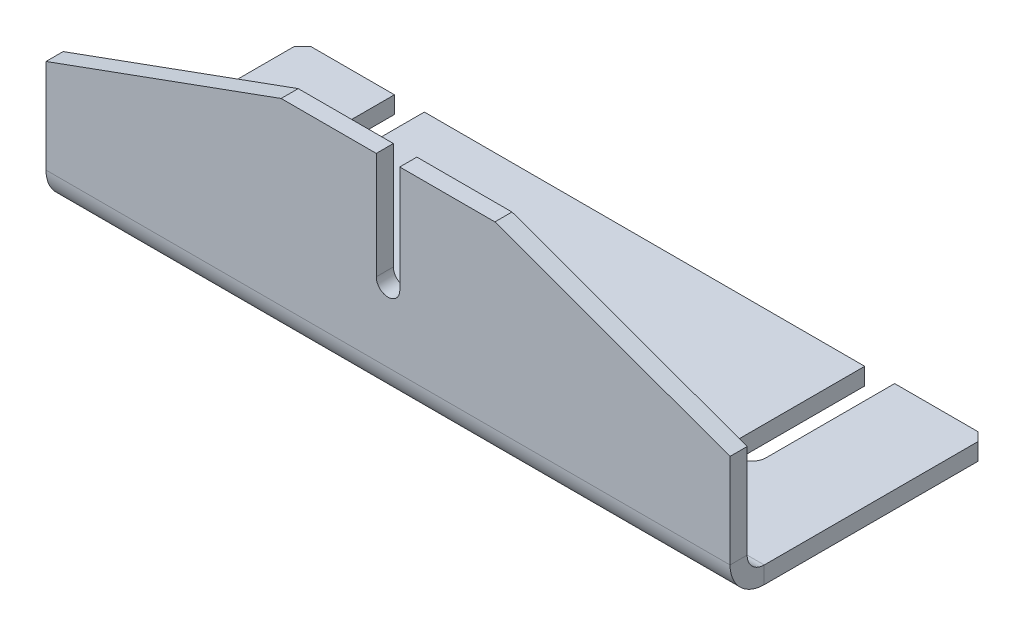
from build123d import *

# Parameters (mm, degrees)
BASE_FLANGE1_DEPTH = 80
CUT_EXTRUDE1_DEPTH = 110.708705215
SKETCH8_R          = 3.5
SKETCH8_W          = 7
SKETCH8_H          = 60
CUT_EXTRUDE2_DEPTH = 111.072703247
CHAMFER1_SIZE      = 2


# Sheet-metal steps are written as plain solids
with BuildPart() as part:
    # Sketch1 → Base-Flange1 (new, symmetric)
    with BuildSketch(Plane(origin=(0, 0, 0), x_dir=(0, 0, -1), z_dir=(1, 0, 0))):
        with BuildLine():
            Line((0, 50), (0, 8))
            ThreePointArc((0, 8), (2.343145751, 2.343145751), (8, 0))
            Line((8, 0), (60, 0))
            Line((60, 0), (60, 4))
            Line((60, 4), (8, 4))
            ThreePointArc((8, 4), (5.171572875, 5.171572875), (4, 8))
            Line((4, 8), (4, 50))
            Line((4, 50), (0, 50))
        make_face()
    extrude(amount=BASE_FLANGE1_DEPTH, both=True)

    # Sketch7 → Cut-Extrude1 (cut, through all)
    with BuildSketch(Plane(origin=(0, 0, -4), x_dir=(-1, 0, 0), z_dir=(0, 0, -1))):
        with BuildLine():
            Line((2.75, 50), (-2.75, 50))
            Line((-2.75, 50), (-2.75, 25))
            ThreePointArc((-2.75, 25), (0, 27.75), (2.75, 25))
            Line((2.75, 25), (2.75, 50))
        make_face()
        with BuildLine():
            ThreePointArc((2.75, 25), (0, 27.75), (-2.75, 25))
            Line((-2.75, 25), (2.75, 25))
        make_face()
        with BuildLine():
            Line((2.75, 25), (-2.75, 25))
            ThreePointArc((-2.75, 25), (0, 22.25), (2.75, 25))
        make_face()
        Polygon((-80, 30), (-25, 50), (-80, 50), align=None)
        Polygon((80, 50), (25, 50), (80, 30), align=None)
    extrude(amount=-CUT_EXTRUDE1_DEPTH, mode=Mode.SUBTRACT)

    # Sketch8 → Cut-Extrude2 (cut, through all)
    with BuildSketch(Plane(origin=(0, 4, 0), x_dir=(1, 0, 0), z_dir=(0, 1, 0))):
        with Locations((-55, 30)):
            Circle(SKETCH8_R)
        with Locations((55, 30)):
            Circle(SKETCH8_R)
        with Locations((-55, 60)):
            Rectangle(SKETCH8_W, SKETCH8_H)
        with Locations((55, 60)):
            Rectangle(SKETCH8_W, SKETCH8_H)
    extrude(amount=-CUT_EXTRUDE2_DEPTH, mode=Mode.SUBTRACT)

    # Chamfer1
    chamfer1_edges = [part.edges().sort_by_distance(p)[0] for p in [
        (80, 2, -60),
        (-80, 2, -60),
    ]]
    chamfer(chamfer1_edges, length=CHAMFER1_SIZE)


solid = part.part
